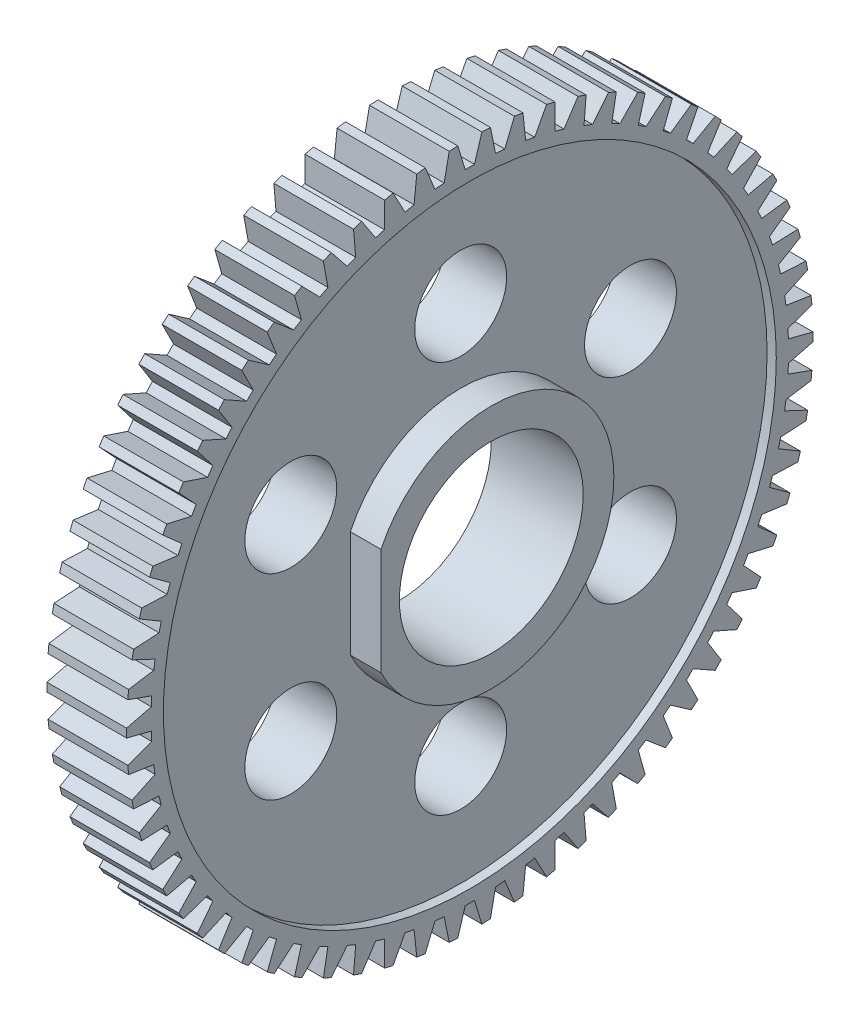
from build123d import *

# Parameters (mm, degrees)
SKETCH1_R           = 50
SKETCH1_R_2         = 7.5
BOSS_EXTRUDE1_DEPTH = 10
SKETCH1_3_R         = 15
BOSS_EXTRUDE2_DEPTH = 15
SKETCH4_W           = 13
SKETCH4_H           = 2
BOSS_EXTRUDE3_START = 1.5
BOSS_EXTRUDE3_DEPTH = 13
CIRPATTERN1_COUNT   = 66


with BuildPart() as part:
    # Sketch1 → Boss-Extrude1 (new body)
    with BuildSketch(Plane.YZ):
        with Locations(Location((0, 0, 0), (0, 0, 270))):
            Circle(SKETCH1_R)
        with Locations(Location((16, 27.712812921, 0), (0, 0, 270))):
            Circle(SKETCH1_R_2, mode=Mode.SUBTRACT)
        with Locations(Location((-16, 27.712812921, 0), (0, 0, 270))):
            Circle(SKETCH1_R_2, mode=Mode.SUBTRACT)
        with Locations(Location((-32, 0, 0), (0, 0, 270))):
            Circle(SKETCH1_R_2, mode=Mode.SUBTRACT)
        with Locations(Location((-16, -27.712812921, 0), (0, 0, 270))):
            Circle(SKETCH1_R_2, mode=Mode.SUBTRACT)
        with Locations(Location((16, -27.712812921, 0), (0, 0, 270))):
            Circle(SKETCH1_R_2, mode=Mode.SUBTRACT)
        with Locations(Location((32, 0, 0), (0, 0, 270))):
            Circle(SKETCH1_R_2, mode=Mode.SUBTRACT)
        with BuildLine():
            ThreePointArc((-8.717797887, 18), (0, -20), (8.717797887, 18))
            Line((8.717797887, 18), (-8.717797887, 18))
        make_face(mode=Mode.SUBTRACT)
    extrude(amount=BOSS_EXTRUDE1_DEPTH)

    # Sketch1<3> → Boss-Extrude2 (add)
    with BuildSketch(Plane.YZ):
        with BuildLine():
            Line((-8.717797887, 18), (8.717797887, 18))
            ThreePointArc((8.717797887, 18), (0, -20), (-8.717797887, 18))
        make_face()
        with Locations(Location((0, 0, 0), (0, 0, 270))):
            Circle(SKETCH1_3_R, mode=Mode.SUBTRACT)
    extrude(amount=BOSS_EXTRUDE2_DEPTH)

    # Sketch4 → Revolve1 (revolve)
    with BuildSketch(Plane(origin=(0, 0, 0), x_dir=(-1, 0, 0), z_dir=(0, 1, 0)), mode=Mode.PRIVATE) as revolve1_sk:
        with Locations((-5, 51)):
            Rectangle(SKETCH4_W, SKETCH4_H)
    revolve(revolve1_sk.sketch.rotate(Axis((22.112300424, 0, 0), (-1, 0, 0)), 180), axis=Axis((22.112300424, 0, 0), (-1, 0, 0)))

    # Sketch2 → Boss-Extrude3 (add)
    with BuildSketch(Plane.YZ.offset(10).offset(BOSS_EXTRUDE3_START)):
        with BuildLine():
            Line((0.7, 55.995624829), (-0.7, 55.995624829))
            Line((-0.7, 55.995624829), (-1.72139135, 51.971499996))
            ThreePointArc((-1.72139135, 51.971499996), (0, 52), (1.72139135, 51.971499996))
            Line((1.72139135, 51.971499996), (0.7, 55.995624829))
        make_face()
    boss_extrude3 = extrude(amount=-BOSS_EXTRUDE3_DEPTH)

    # CirPattern1: Boss-Extrude3 ×66 about axis
    cirpattern1_axis = Axis((0, 0, 0), (1, 0, 0))
    for i in range(1, CIRPATTERN1_COUNT):
        add(boss_extrude3.rotate(cirpattern1_axis, i * 360 / CIRPATTERN1_COUNT))


solid = part.part
